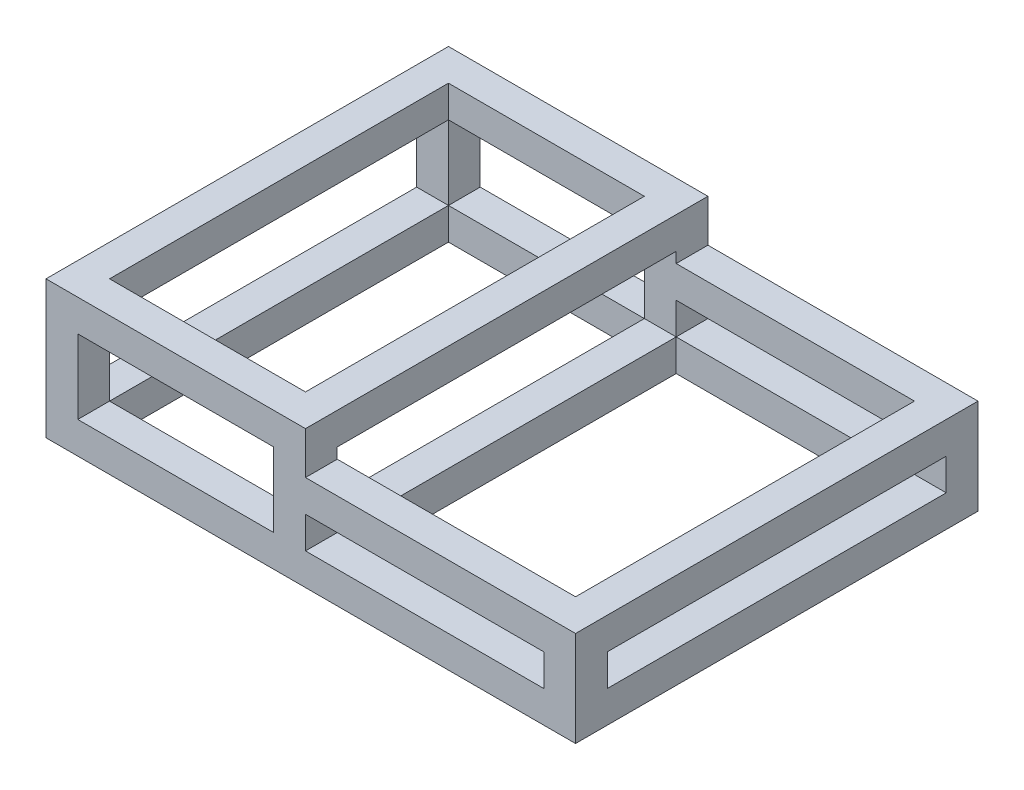
from build123d import *

# Parameters (mm, degrees)
SKETCH1_W                = 185
SKETCH1_H                = 70
SKETCH1_W_2              = 225
SKETCH1_H_2              = 30
BOSS_EXTRUDE1_DEPTH      = 380
CUT_EXTRUDE1_START       = -130
CUT_EXTRUDE1_OUTLINE_W   = 225
CUT_EXTRUDE1_OUTLINE_H   = 320
CUT_EXTRUDE1_OUTLINE_W_2 = 185
CUT_EXTRUDE1_DEPTH       = 130
SKETCH3_W                = 320
SKETCH3_H                = 30
CUT_EXTRUDE2_DEPTH       = 30
SKETCH4_W                = 320
SKETCH4_H                = 70
CUT_EXTRUDE3_DEPTH       = 245


# Read off the part's stored shape, not the designer's step: Cut-Extrude1
with BuildPart() as part:
    # Sketch1 → Boss-Extrude1 (new body)
    with BuildSketch(Plane.XY):
        Polygon((250, 25), (-5, 25), (-5, 65), (-250, 65), (-250, -65), (250, -65), align=None)
        with Locations((-127.5, 0)):
            Rectangle(SKETCH1_W, SKETCH1_H, mode=Mode.SUBTRACT)
        with Locations((107.5, -20)):
            Rectangle(SKETCH1_W_2, SKETCH1_H_2, mode=Mode.SUBTRACT)
    extrude(amount=BOSS_EXTRUDE1_DEPTH)

    # Cut-Extrude1 outline → Cut-Extrude1 (cut)
    with BuildSketch(Plane(origin=(0, 65, 0), x_dir=(1, 0, 0), z_dir=(0, 1, 0)).offset(CUT_EXTRUDE1_START)):
        with Locations((107.5, -190)):
            Rectangle(CUT_EXTRUDE1_OUTLINE_W, CUT_EXTRUDE1_OUTLINE_H)
        with Locations((-127.5, -190)):
            Rectangle(CUT_EXTRUDE1_OUTLINE_W_2, CUT_EXTRUDE1_OUTLINE_H)
    extrude(amount=CUT_EXTRUDE1_DEPTH, mode=Mode.SUBTRACT)

    # Sketch3 → Cut-Extrude2 (cut)
    with BuildSketch(Plane(origin=(250, 0, 0), x_dir=(0, 0, -1), z_dir=(1, 0, 0))):
        with Locations((-190, -20)):
            Rectangle(SKETCH3_W, SKETCH3_H)
    extrude(amount=-CUT_EXTRUDE2_DEPTH, mode=Mode.SUBTRACT)

    # Sketch4 → Cut-Extrude3 (cut)
    with BuildSketch(Plane.ZY.offset(250)):
        with Locations((190, 0)):
            Rectangle(SKETCH4_W, SKETCH4_H)
    extrude(amount=-CUT_EXTRUDE3_DEPTH, mode=Mode.SUBTRACT)


solid = part.part
